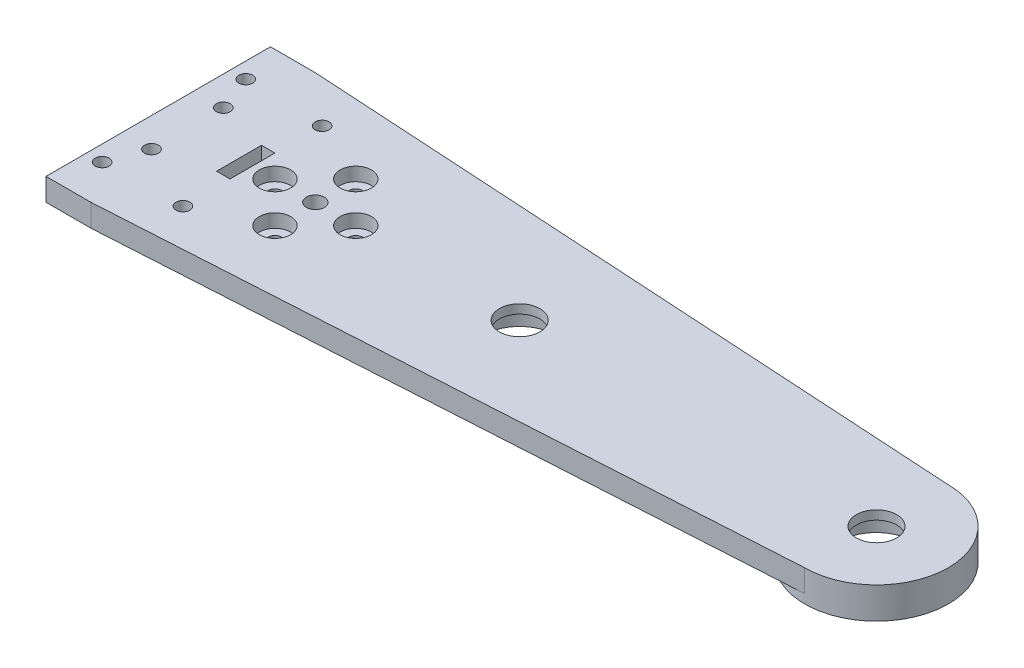
from build123d import *
from build123d.topology import SkipClean

# Parameters (mm, degrees)
SKETCH28_R           = 1.55
SKETCH28_R_2         = 4.5
SKETCH28_R_3         = 2
SKETCH28_W           = 10
SKETCH28_H           = 3
BOSS_EXTRUDE10_DEPTH = 5
SKETCH29_R           = 16
BOSS_EXTRUDE11_DEPTH = 2
SKETCH30_R           = 8.2
CUT_EXTRUDE1_DEPTH   = 5
SKETCH31_R           = 3.5
CUT_EXTRUDE2_DEPTH   = 3


with BuildPart() as part:
    # Sketch28 → Boss-Extrude10 (new body)
    with BuildSketch(Plane(origin=(-32, 0, 0), x_dir=(0, 0, 1), z_dir=(0, -1, 0))):
        with BuildLine():
            Line((-25, 15), (25, 15))
            Line((25, 15), (25, 5))
            Line((25, 5), (16, -145))
            ThreePointArc((16, -145), (0, -161), (-16, -145))
            Line((-16, -145), (-25, 5))
            Line((-25, 5), (-25, 15))
        make_face()
        with Locations((8, 8.5)):
            Circle(SKETCH28_R, mode=Mode.SUBTRACT)
        with Locations((-8, 8.5)):
            Circle(SKETCH28_R, mode=Mode.SUBTRACT)
        with Locations((16, 11.5)):
            Circle(SKETCH28_R, mode=Mode.SUBTRACT)
        with Locations((-16, 11.5)):
            Circle(SKETCH28_R, mode=Mode.SUBTRACT)
        with Locations((-15.5, -6)):
            Circle(SKETCH28_R, mode=Mode.SUBTRACT)
        with Locations((15.5, -6)):
            Circle(SKETCH28_R, mode=Mode.SUBTRACT)
        with Locations((0, -65.5)):
            Circle(SKETCH28_R_2, mode=Mode.SUBTRACT)
        with Locations((0, -20)):
            Circle(SKETCH28_R_3, mode=Mode.SUBTRACT)
        with Locations((0, -145)):
            Circle(SKETCH28_R_2, mode=Mode.SUBTRACT)
        with Locations((-9, -20)):
            Circle(SKETCH28_R, mode=Mode.SUBTRACT)
        with Locations((0, -11)):
            Circle(SKETCH28_R, mode=Mode.SUBTRACT)
        with Locations((9, -20)):
            Circle(SKETCH28_R, mode=Mode.SUBTRACT)
        with Locations((0, -29)):
            Circle(SKETCH28_R, mode=Mode.SUBTRACT)
        with Locations((0, -4.5)):
            Rectangle(SKETCH28_W, SKETCH28_H, mode=Mode.SUBTRACT)
    extrude(amount=BOSS_EXTRUDE10_DEPTH)

    # Sketch29 → Boss-Extrude11 (add)
    with SkipClean():  # the faces are left unmerged after this step: merging them gives an invalid solid
        with BuildSketch(Plane.XZ.offset(5)):
            with Locations((33.5, 0)):
                Circle(SKETCH29_R)
            with Locations((113, 0)):
                Circle(SKETCH29_R)
        extrude(amount=BOSS_EXTRUDE11_DEPTH)
    add(part.part.scale(1), mode=Mode.REPLACE)  # the faces are merged on a copy

    # Sketch30 → Cut-Extrude1 (cut)
    with BuildSketch(Plane.XZ.offset(7)):
        with Locations((33.5, 0)):
            Circle(SKETCH30_R)
        with Locations((113, 0)):
            Circle(SKETCH30_R)
    extrude(amount=-CUT_EXTRUDE1_DEPTH, mode=Mode.SUBTRACT)

    # Sketch31 → Cut-Extrude2 (cut)
    with BuildSketch(Plane(origin=(0, 0, 0), x_dir=(1, 0, 0), z_dir=(0, 1, 0))):
        with Locations((-12, 9)):
            Circle(SKETCH31_R)
        with Locations((-3, 0)):
            Circle(SKETCH31_R)
        with Locations((-12, -9)):
            Circle(SKETCH31_R)
        with Locations((-21, 0)):
            Circle(SKETCH31_R)
    extrude(amount=-CUT_EXTRUDE2_DEPTH, mode=Mode.SUBTRACT)


solid = part.part
